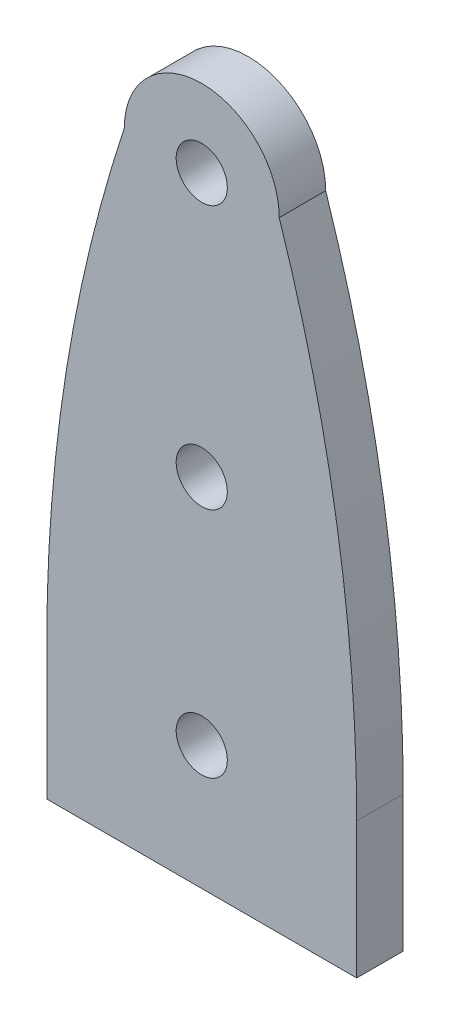
from build123d import *

# Parameters (mm, degrees)
SKETCH_1_R          = 1.65
EXTRUDE_1_DEPTH     = 3
CUT_EXTRUDE_START   = -28
CUT_EXTRUDE_3_DEPTH = 28
FILLET_1_R          = 100


with BuildPart() as part:
    # 草图1 → 凸台-拉伸1 (new body)
    with BuildSketch(Plane.XY):
        with BuildLine():
            Line((0, 0), (20, 0))
            Line((20, 0), (20, 40))
            ThreePointArc((20, 40), (10, 50), (0, 40))
            Line((0, 40), (0, 0))
        make_face()
        with Locations((10, 40)):
            Circle(SKETCH_1_R, mode=Mode.SUBTRACT)
        with Locations((10, 8)):
            Circle(SKETCH_1_R, mode=Mode.SUBTRACT)
        with Locations((10, 23)):
            Circle(SKETCH_1_R, mode=Mode.SUBTRACT)
    extrude(amount=EXTRUDE_1_DEPTH)

    # 草图4 → 切除-拉伸3 (cut)
    with BuildSketch(Plane.XY.offset(3).offset(CUT_EXTRUDE_START)):
        with BuildLine():
            Line((0, 40), (5, 40))
            ThreePointArc((5, 40), (10, 45), (15, 40))
            Line((15, 40), (20, 40))
            ThreePointArc((20, 40), (10, 50), (0, 40))
        make_face()
    extrude(amount=CUT_EXTRUDE_3_DEPTH, mode=Mode.SUBTRACT)

    # 圆角1
    # the kernel refuses this fillet: 100 mm, written as the material it takes off along each edge
    with BuildSketch(Plane(origin=(20, 40, -78.06247498), x_dir=(0, -1, 0), z_dir=(0, 0, 1))) as fillet_1_piece_1:
        with BuildLine():
            CenterArc((31.224989992, -100), FILLET_1_R, 90, 18.194872339)
            Line((0, -5), (0, 0))
            Line((0, 0), (31.224989992, 0))
        make_face()
    extrude(amount=159.12494996, mode=Mode.SUBTRACT)
    with BuildSketch(Plane(origin=(0, 40, -78.06247498), x_dir=(0, -1, 0), z_dir=(0, 0, 1))) as fillet_1_piece_2:
        with BuildLine():
            CenterArc((31.224989992, 100), FILLET_1_R, 251.805127661, 18.194872339)
            Line((0, 5), (0, 0))
            Line((0, 0), (31.224989992, 0))
        make_face()
    extrude(amount=159.12494996, mode=Mode.SUBTRACT)


solid = part.part
